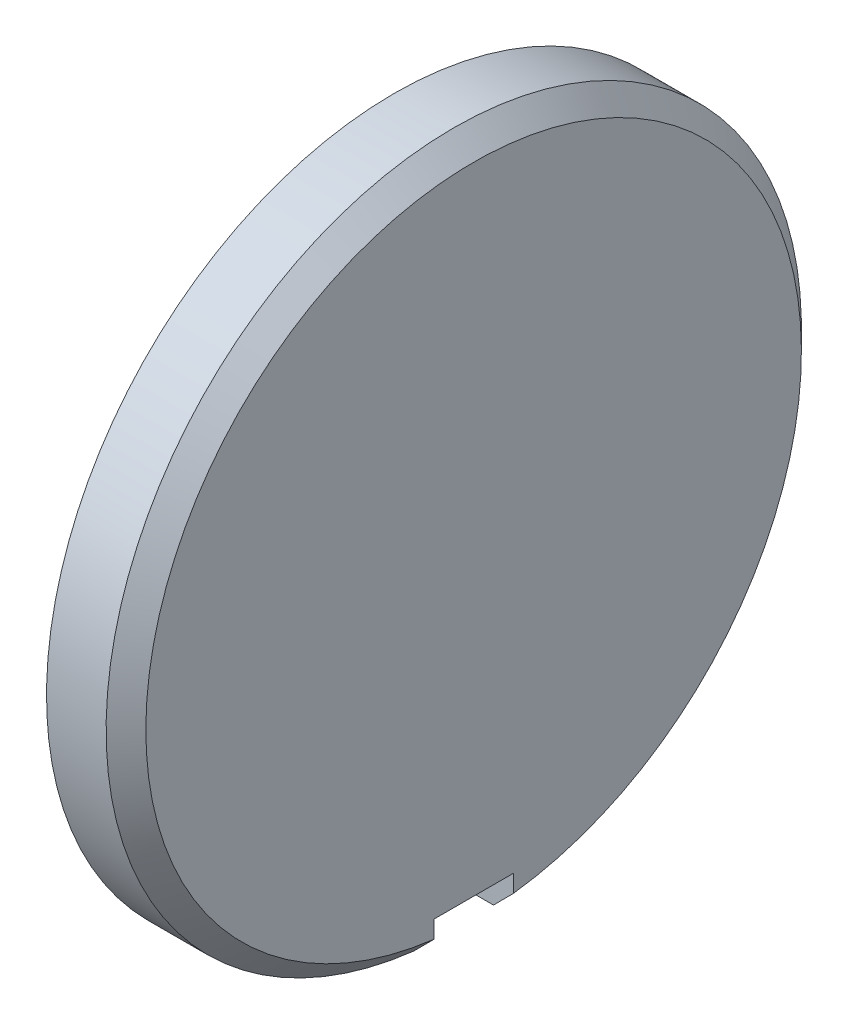
from build123d import *

# Parameters (mm, degrees)
BOSS_EXTRUDE1_START = -55.2
SKETCH2_W           = 1.28
SKETCH2_H           = 0.8
BOSS_EXTRUDE1_DEPTH = 6.4
BOSS_EXTRUDE2_START = -52.4
SKETCH3_W           = 1.28
SKETCH3_H           = 6.4
BOSS_EXTRUDE2_DEPTH = 0.8
BOSS_EXTRUDE3_START = -52.8
SKETCH4_W           = 1.8
SKETCH4_H           = 0.9
BOSS_EXTRUDE3_DEPTH = 1.6


with BuildPart() as part:
    # Sketch1 → Revolve1 (revolve)
    with BuildSketch(Plane.XY.offset(-52)):
        Polygon((82.8, -62.7), (84, -62.7), (84, -65), (85.6, -65), (85.6, -58.4), (85.2, -58), (84, -58), (84, -62), (82.8, -62), align=None)
    revolve(axis=Axis((77.8, -65, -52), (1, 0, 0)))


with BuildPart() as body_2:
    # Sketch2 → Boss-Extrude1 (new body)
    with BuildSketch(Plane.XY.offset(BOSS_EXTRUDE1_START)):
        with Locations((83.34, -65)):
            Rectangle(SKETCH2_W, SKETCH2_H)
    extrude(amount=BOSS_EXTRUDE1_DEPTH)


with BuildPart() as part_1:
    add(part.part)

    # Combine1: cut body 2
    add(body_2.part, mode=Mode.SUBTRACT)


with BuildPart() as body_2_2:
    # Sketch3 → Boss-Extrude2 (new body)
    with BuildSketch(Plane.XY.offset(BOSS_EXTRUDE2_START)):
        with Locations((83.34, -65)):
            Rectangle(SKETCH3_W, SKETCH3_H)
    extrude(amount=BOSS_EXTRUDE2_DEPTH)


with BuildPart() as part_2:
    add(part_1.part)

    # Combine2: cut body 2 2
    add(body_2_2.part, mode=Mode.SUBTRACT)


with BuildPart() as body_2_3:
    # Sketch4 → Boss-Extrude3 (new body)
    with BuildSketch(Plane.XY.offset(BOSS_EXTRUDE3_START)):
        with Locations((84.8, -71.65)):
            Rectangle(SKETCH4_W, SKETCH4_H)
    extrude(amount=BOSS_EXTRUDE3_DEPTH)


with BuildPart() as part_3:
    add(part_2.part)

    # Combine3: cut body 2 3
    add(body_2_3.part, mode=Mode.SUBTRACT)


solid = part_3.part
